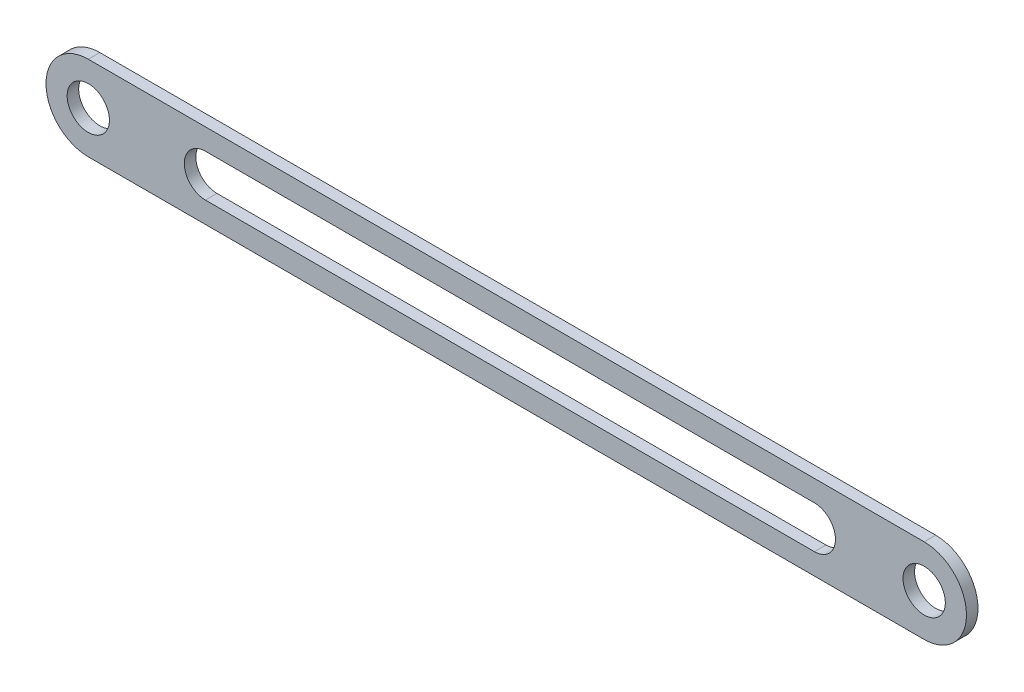
from build123d import *

# Parameters (mm, degrees)
SKETCH1_R           = 5.5
BOSS_EXTRUDE1_DEPTH = 3


with BuildPart() as part:
    # Sketch1 → Boss-Extrude1 (new body)
    with BuildSketch(Plane.XY):
        with BuildLine():
            Line((-108.725, 11), (108.725, 11))
            ThreePointArc((108.725, 11), (119.725, 0), (108.725, -11))
            Line((108.725, -11), (-108.725, -11))
            ThreePointArc((-108.725, -11), (-119.725, 0), (-108.725, 11))
        make_face()
        with Locations((-108.725, 0)):
            Circle(SKETCH1_R, mode=Mode.SUBTRACT)
        with Locations((108.725, 0)):
            Circle(SKETCH1_R, mode=Mode.SUBTRACT)
        with BuildLine():
            Line((-78.255, 5.5), (80.145, 5.5))
            ThreePointArc((80.145, 5.5), (85.645, 0), (80.145, -5.5))
            Line((80.145, -5.5), (-78.255, -5.5))
            ThreePointArc((-78.255, -5.5), (-83.755, 0), (-78.255, 5.5))
        make_face(mode=Mode.SUBTRACT)
    extrude(amount=BOSS_EXTRUDE1_DEPTH)


solid = part.part
